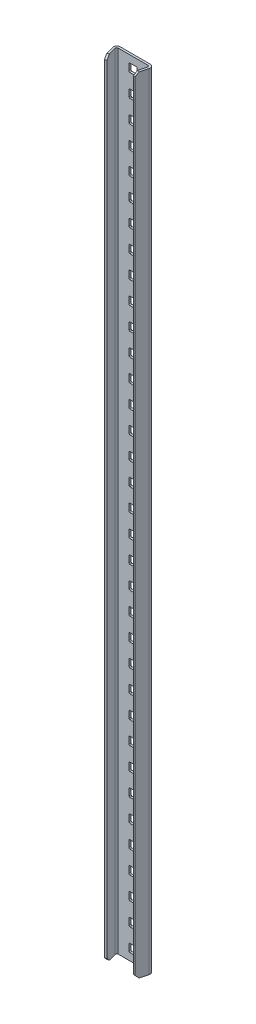
from build123d import *

# Parameters (mm, degrees)
BOSS_EXTRUDE1_DEPTH = 444.5
SKETCH2_W           = 4.6228
SKETCH2_H           = 4.6228
CUT_EXTRUDE1_DEPTH  = 293.384620107
SKETCH3_W           = 4.6228
SKETCH3_H           = 4.6228
CUT_EXTRUDE2_DEPTH  = 293.384620107
SKETCH4_W           = 4.6228
SKETCH4_H           = 4.6228
CUT_EXTRUDE3_DEPTH  = 293.384620107
SKETCH5_W           = 4.6228
SKETCH5_H           = 4.6228
CUT_EXTRUDE4_DEPTH  = 293.384620107
SKETCH6_W           = 4.6228
SKETCH6_H           = 4.6228
CUT_EXTRUDE5_DEPTH  = 293.384620107
SKETCH7_W           = 4.6228
SKETCH7_H           = 4.6228
CUT_EXTRUDE6_DEPTH  = 293.384620107
SKETCH8_W           = 4.6228
SKETCH8_H           = 4.6228
CUT_EXTRUDE7_DEPTH  = 293.384620107
SKETCH9_W           = 4.6228
SKETCH9_H           = 4.6228
CUT_EXTRUDE8_DEPTH  = 293.384620107
SKETCH10_W          = 4.6228
SKETCH10_H          = 4.6228
CUT_EXTRUDE9_DEPTH  = 293.384620107
SKETCH11_W          = 4.6228
SKETCH11_H          = 4.6228
CUT_EXTRUDE10_DEPTH = 293.384620107
SKETCH12_W          = 4.6228
SKETCH12_H          = 4.6228
CUT_EXTRUDE11_DEPTH = 293.384620107
SKETCH13_W          = 4.6228
SKETCH13_H          = 4.6228
CUT_EXTRUDE12_DEPTH = 293.384620107
SKETCH14_W          = 4.6228
SKETCH14_H          = 4.6228
CUT_EXTRUDE13_DEPTH = 293.384620107
SKETCH15_W          = 4.6228
SKETCH15_H          = 4.6228
CUT_EXTRUDE14_DEPTH = 293.384620107
SKETCH16_W          = 4.6228
SKETCH16_H          = 4.6228
CUT_EXTRUDE15_DEPTH = 293.384620107
SKETCH17_W          = 4.6228
SKETCH17_H          = 4.6228
CUT_EXTRUDE16_DEPTH = 293.384620107
SKETCH18_W          = 4.6228
SKETCH18_H          = 4.6228
CUT_EXTRUDE17_DEPTH = 293.384620107
SKETCH19_W          = 4.6228
SKETCH19_H          = 4.6228
CUT_EXTRUDE18_DEPTH = 293.384620107
SKETCH20_W          = 4.6228
SKETCH20_H          = 4.6228
CUT_EXTRUDE19_DEPTH = 293.384620107
SKETCH21_W          = 4.6228
SKETCH21_H          = 4.6228
CUT_EXTRUDE20_DEPTH = 293.384620107
SKETCH22_W          = 4.6228
SKETCH22_H          = 4.6228
CUT_EXTRUDE21_DEPTH = 293.384620107
SKETCH23_W          = 4.6228
SKETCH23_H          = 4.6228
CUT_EXTRUDE22_DEPTH = 293.384620107
SKETCH24_W          = 4.6228
SKETCH24_H          = 4.6228
CUT_EXTRUDE23_DEPTH = 293.384620107
SKETCH25_W          = 4.6228
SKETCH25_H          = 4.6228
CUT_EXTRUDE24_DEPTH = 293.384620107
SKETCH26_W          = 4.6228
SKETCH26_H          = 4.6228
CUT_EXTRUDE25_DEPTH = 293.384620107
SKETCH27_W          = 4.6228
SKETCH27_H          = 4.6228
CUT_EXTRUDE26_DEPTH = 293.384620107
SKETCH28_W          = 4.6228
SKETCH28_H          = 4.6228
CUT_EXTRUDE27_DEPTH = 293.384620107
SKETCH29_W          = 4.6228
SKETCH29_H          = 4.6228
CUT_EXTRUDE28_DEPTH = 293.384620107
SKETCH30_W          = 4.6228
SKETCH30_H          = 4.6228
CUT_EXTRUDE29_DEPTH = 293.384620107
SKETCH31_W          = 4.6228
SKETCH31_H          = 4.6228
CUT_EXTRUDE30_DEPTH = 293.384620107
SKETCH32_W          = 4.6228
SKETCH32_H          = 4.6228
CUT_EXTRUDE31_DEPTH = 293.384620107
SKETCH33_W          = 4.6228
SKETCH33_H          = 4.6228
CUT_EXTRUDE32_DEPTH = 293.384620107
SKETCH34_W          = 4.6228
SKETCH34_H          = 4.6228
CUT_EXTRUDE33_DEPTH = 293.384620107
SKETCH35_W          = 4.6228
SKETCH35_H          = 4.6228
CUT_EXTRUDE34_DEPTH = 293.384620107
SKETCH36_W          = 4.6228
SKETCH36_H          = 4.6228
CUT_EXTRUDE35_DEPTH = 293.418269127
CHAMFER1_SIZE       = 1.905
FILLET1_R           = 0.508


with BuildPart() as part:
    # Sketch1 → Boss-Extrude1 (new body)
    with BuildSketch(Plane(origin=(0, 292.1, 0), x_dir=(1, 0, 0), z_dir=(0, 1, 0))):
        with BuildLine():
            Line((9.195785156, -2.151415434), (7.497741104, -8.488602111))
            Line((7.497741104, -8.488602111), (8.656852096, -8.799184965))
            Line((8.656852096, -8.799184965), (10.354896148, -2.461998288))
            ThreePointArc((10.354896148, -2.461998288), (10.01737888, -0.765184397), (8.465738417, 0))
            Line((8.465738417, 0), (-8.465738417, 0))
            ThreePointArc((-8.465738417, 0), (-10.01737888, -0.765184397), (-10.354896148, -2.461998288))
            Line((-10.354896148, -2.461998288), (-8.656852096, -8.799184965))
            Line((-8.656852096, -8.799184965), (-7.497741104, -8.488602111))
            Line((-7.497741104, -8.488602111), (-9.195785156, -2.151415434))
            ThreePointArc((-9.195785156, -2.151415434), (-9.065354872, -1.495698112), (-8.465738417, -1.2))
            Line((-8.465738417, -1.2), (8.465738417, -1.2))
            ThreePointArc((8.465738417, -1.2), (9.065354872, -1.495698112), (9.195785156, -2.151415434))
        make_face()
    extrude(amount=-BOSS_EXTRUDE1_DEPTH)

    # Sketch2 → Cut-Extrude1 (cut, through all)
    with BuildSketch(Plane.XY.offset(1.2)):
        with Locations((0, 146.05)):
            Rectangle(SKETCH2_W, SKETCH2_H)
    extrude(amount=-CUT_EXTRUDE1_DEPTH, mode=Mode.SUBTRACT)

    # Sketch3 → Cut-Extrude2 (cut, through all)
    with BuildSketch(Plane.XY.offset(1.2)):
        with Locations((0, 133.35)):
            Rectangle(SKETCH3_W, SKETCH3_H)
    extrude(amount=-CUT_EXTRUDE2_DEPTH, mode=Mode.SUBTRACT)

    # Sketch4 → Cut-Extrude3 (cut, through all)
    with BuildSketch(Plane.XY.offset(1.2)):
        with Locations((0, 120.65)):
            Rectangle(SKETCH4_W, SKETCH4_H)
    extrude(amount=-CUT_EXTRUDE3_DEPTH, mode=Mode.SUBTRACT)

    # Sketch5 → Cut-Extrude4 (cut, through all)
    with BuildSketch(Plane.XY.offset(1.2)):
        with Locations((0, 107.95)):
            Rectangle(SKETCH5_W, SKETCH5_H)
    extrude(amount=-CUT_EXTRUDE4_DEPTH, mode=Mode.SUBTRACT)

    # Sketch6 → Cut-Extrude5 (cut, through all)
    with BuildSketch(Plane.XY.offset(1.2)):
        with Locations((0, 95.25)):
            Rectangle(SKETCH6_W, SKETCH6_H)
    extrude(amount=-CUT_EXTRUDE5_DEPTH, mode=Mode.SUBTRACT)

    # Sketch7 → Cut-Extrude6 (cut, through all)
    with BuildSketch(Plane.XY.offset(1.2)):
        with Locations((0, 82.55)):
            Rectangle(SKETCH7_W, SKETCH7_H)
    extrude(amount=-CUT_EXTRUDE6_DEPTH, mode=Mode.SUBTRACT)

    # Sketch8 → Cut-Extrude7 (cut, through all)
    with BuildSketch(Plane.XY.offset(1.2)):
        with Locations((0, 69.85)):
            Rectangle(SKETCH8_W, SKETCH8_H)
    extrude(amount=-CUT_EXTRUDE7_DEPTH, mode=Mode.SUBTRACT)

    # Sketch9 → Cut-Extrude8 (cut, through all)
    with BuildSketch(Plane.XY.offset(1.2)):
        with Locations((0, 57.15)):
            Rectangle(SKETCH9_W, SKETCH9_H)
    extrude(amount=-CUT_EXTRUDE8_DEPTH, mode=Mode.SUBTRACT)

    # Sketch10 → Cut-Extrude9 (cut, through all)
    with BuildSketch(Plane.XY.offset(1.2)):
        with Locations((0, 44.45)):
            Rectangle(SKETCH10_W, SKETCH10_H)
    extrude(amount=-CUT_EXTRUDE9_DEPTH, mode=Mode.SUBTRACT)

    # Sketch11 → Cut-Extrude10 (cut, through all)
    with BuildSketch(Plane.XY.offset(1.2)):
        with Locations((0, 31.75)):
            Rectangle(SKETCH11_W, SKETCH11_H)
    extrude(amount=-CUT_EXTRUDE10_DEPTH, mode=Mode.SUBTRACT)

    # Sketch12 → Cut-Extrude11 (cut, through all)
    with BuildSketch(Plane.XY.offset(1.2)):
        with Locations((0, 19.05)):
            Rectangle(SKETCH12_W, SKETCH12_H)
    extrude(amount=-CUT_EXTRUDE11_DEPTH, mode=Mode.SUBTRACT)

    # Sketch13 → Cut-Extrude12 (cut, through all)
    with BuildSketch(Plane.XY.offset(1.2)):
        with Locations((0, 6.35)):
            Rectangle(SKETCH13_W, SKETCH13_H)
    extrude(amount=-CUT_EXTRUDE12_DEPTH, mode=Mode.SUBTRACT)

    # Sketch14 → Cut-Extrude13 (cut, through all)
    with BuildSketch(Plane.XY.offset(1.2)):
        with Locations((0, -6.35)):
            Rectangle(SKETCH14_W, SKETCH14_H)
    extrude(amount=-CUT_EXTRUDE13_DEPTH, mode=Mode.SUBTRACT)

    # Sketch15 → Cut-Extrude14 (cut, through all)
    with BuildSketch(Plane.XY.offset(1.2)):
        with Locations((0, -133.35)):
            Rectangle(SKETCH15_W, SKETCH15_H)
    extrude(amount=-CUT_EXTRUDE14_DEPTH, mode=Mode.SUBTRACT)

    # Sketch16 → Cut-Extrude15 (cut, through all)
    with BuildSketch(Plane.XY.offset(1.2)):
        with Locations((0, -146.05)):
            Rectangle(SKETCH16_W, SKETCH16_H)
    extrude(amount=-CUT_EXTRUDE15_DEPTH, mode=Mode.SUBTRACT)

    # Sketch17 → Cut-Extrude16 (cut, through all)
    with BuildSketch(Plane.XY.offset(1.2)):
        with Locations((0, -120.65)):
            Rectangle(SKETCH17_W, SKETCH17_H)
    extrude(amount=-CUT_EXTRUDE16_DEPTH, mode=Mode.SUBTRACT)

    # Sketch18 → Cut-Extrude17 (cut, through all)
    with BuildSketch(Plane.XY.offset(1.2)):
        with Locations((0, -107.95)):
            Rectangle(SKETCH18_W, SKETCH18_H)
    extrude(amount=-CUT_EXTRUDE17_DEPTH, mode=Mode.SUBTRACT)

    # Sketch19 → Cut-Extrude18 (cut, through all)
    with BuildSketch(Plane.XY.offset(1.2)):
        with Locations((0, -95.25)):
            Rectangle(SKETCH19_W, SKETCH19_H)
    extrude(amount=-CUT_EXTRUDE18_DEPTH, mode=Mode.SUBTRACT)

    # Sketch20 → Cut-Extrude19 (cut, through all)
    with BuildSketch(Plane.XY.offset(1.2)):
        with Locations((0, -82.55)):
            Rectangle(SKETCH20_W, SKETCH20_H)
    extrude(amount=-CUT_EXTRUDE19_DEPTH, mode=Mode.SUBTRACT)

    # Sketch21 → Cut-Extrude20 (cut, through all)
    with BuildSketch(Plane.XY.offset(1.2)):
        with Locations((0, -69.85)):
            Rectangle(SKETCH21_W, SKETCH21_H)
    extrude(amount=-CUT_EXTRUDE20_DEPTH, mode=Mode.SUBTRACT)

    # Sketch22 → Cut-Extrude21 (cut, through all)
    with BuildSketch(Plane.XY.offset(1.2)):
        with Locations((0, -57.15)):
            Rectangle(SKETCH22_W, SKETCH22_H)
    extrude(amount=-CUT_EXTRUDE21_DEPTH, mode=Mode.SUBTRACT)

    # Sketch23 → Cut-Extrude22 (cut, through all)
    with BuildSketch(Plane.XY.offset(1.2)):
        with Locations((0, -44.45)):
            Rectangle(SKETCH23_W, SKETCH23_H)
    extrude(amount=-CUT_EXTRUDE22_DEPTH, mode=Mode.SUBTRACT)

    # Sketch24 → Cut-Extrude23 (cut, through all)
    with BuildSketch(Plane.XY.offset(1.2)):
        with Locations((0, -31.75)):
            Rectangle(SKETCH24_W, SKETCH24_H)
    extrude(amount=-CUT_EXTRUDE23_DEPTH, mode=Mode.SUBTRACT)

    # Sketch25 → Cut-Extrude24 (cut, through all)
    with BuildSketch(Plane.XY.offset(1.2)):
        with Locations((0, 158.75)):
            Rectangle(SKETCH25_W, SKETCH25_H)
    extrude(amount=-CUT_EXTRUDE24_DEPTH, mode=Mode.SUBTRACT)

    # Sketch26 → Cut-Extrude25 (cut, through all)
    with BuildSketch(Plane.XY.offset(1.2)):
        with Locations((0, 171.45)):
            Rectangle(SKETCH26_W, SKETCH26_H)
    extrude(amount=-CUT_EXTRUDE25_DEPTH, mode=Mode.SUBTRACT)

    # Sketch27 → Cut-Extrude26 (cut, through all)
    with BuildSketch(Plane.XY.offset(1.2)):
        with Locations((0, 184.15)):
            Rectangle(SKETCH27_W, SKETCH27_H)
    extrude(amount=-CUT_EXTRUDE26_DEPTH, mode=Mode.SUBTRACT)

    # Sketch28 → Cut-Extrude27 (cut, through all)
    with BuildSketch(Plane.XY.offset(1.2)):
        with Locations((0, 196.85)):
            Rectangle(SKETCH28_W, SKETCH28_H)
    extrude(amount=-CUT_EXTRUDE27_DEPTH, mode=Mode.SUBTRACT)

    # Sketch29 → Cut-Extrude28 (cut, through all)
    with BuildSketch(Plane.XY.offset(1.2)):
        with Locations((0, 209.55)):
            Rectangle(SKETCH29_W, SKETCH29_H)
    extrude(amount=-CUT_EXTRUDE28_DEPTH, mode=Mode.SUBTRACT)

    # Sketch30 → Cut-Extrude29 (cut, through all)
    with BuildSketch(Plane.XY.offset(1.2)):
        with Locations((0, 222.25)):
            Rectangle(SKETCH30_W, SKETCH30_H)
    extrude(amount=-CUT_EXTRUDE29_DEPTH, mode=Mode.SUBTRACT)

    # Sketch31 → Cut-Extrude30 (cut, through all)
    with BuildSketch(Plane.XY.offset(1.2)):
        with Locations((0, 234.95)):
            Rectangle(SKETCH31_W, SKETCH31_H)
    extrude(amount=-CUT_EXTRUDE30_DEPTH, mode=Mode.SUBTRACT)

    # Sketch32 → Cut-Extrude31 (cut, through all)
    with BuildSketch(Plane.XY.offset(1.2)):
        with Locations((0, 247.65)):
            Rectangle(SKETCH32_W, SKETCH32_H)
    extrude(amount=-CUT_EXTRUDE31_DEPTH, mode=Mode.SUBTRACT)

    # Sketch33 → Cut-Extrude32 (cut, through all)
    with BuildSketch(Plane.XY.offset(1.2)):
        with Locations((0, 260.35)):
            Rectangle(SKETCH33_W, SKETCH33_H)
    extrude(amount=-CUT_EXTRUDE32_DEPTH, mode=Mode.SUBTRACT)

    # Sketch34 → Cut-Extrude33 (cut, through all)
    with BuildSketch(Plane.XY.offset(1.2)):
        with Locations((0, 273.05)):
            Rectangle(SKETCH34_W, SKETCH34_H)
    extrude(amount=-CUT_EXTRUDE33_DEPTH, mode=Mode.SUBTRACT)

    # Sketch35 → Cut-Extrude34 (cut, through all)
    with BuildSketch(Plane.XY.offset(1.2)):
        with Locations((0, 285.75)):
            Rectangle(SKETCH35_W, SKETCH35_H)
    extrude(amount=-CUT_EXTRUDE34_DEPTH, mode=Mode.SUBTRACT)

    # Sketch36 → Cut-Extrude35 (cut, through all)
    with BuildSketch(Plane(origin=(0, 0, 0), x_dir=(-1, 0, 0), z_dir=(0, 0, -1))):
        with Locations((0, -19.05)):
            Rectangle(SKETCH36_W, SKETCH36_H)
    extrude(amount=-CUT_EXTRUDE35_DEPTH, mode=Mode.SUBTRACT)

    # Chamfer1
    chamfer1_edges = [part.edges().sort_by_distance(p)[0] for p in [
        (-8.0772966, 292.1, 8.643893538),
        (-8.0772966, -152.4, 8.643893538),
        (8.0772966, 292.1, 8.643893538),
        (8.0772966, -152.4, 8.643893538),
    ]]
    chamfer(chamfer1_edges, length=CHAMFER1_SIZE)

    # Fillet1
    fillet1_edges = [part.edges().sort_by_distance(p)[0] for p in [
        (2.3114, 110.2614, 0.6),
        (2.3114, 8.6614, 0.6),
        (2.3114, 186.4614, 0.6),
        (2.3114, -21.3614, 0.6),
        (2.3114, 59.4614, 0.6),
        (-2.3114, -21.3614, 0.6),
        (2.3114, 211.8614, 0.6),
        (-2.3114, -16.7386, 0.6),
        (2.3114, 161.0614, 0.6),
        (2.3114, -16.7386, 0.6),
        (2.3114, 34.0614, 0.6),
        (2.3114, -34.0614, 0.6),
        (2.3114, 84.8614, 0.6),
        (-2.3114, -34.0614, 0.6),
        (2.3114, 135.6614, 0.6),
        (-2.3114, -29.4386, 0.6),
        (2.3114, 199.1614, 0.6),
        (2.3114, -29.4386, 0.6),
        (2.3114, 173.7614, 0.6),
        (2.3114, -46.7614, 0.6),
        (2.3114, -4.0386, 0.6),
        (-2.3114, -46.7614, 0.6),
        (2.3114, 21.3614, 0.6),
        (-2.3114, -42.1386, 0.6),
        (2.3114, 46.7614, 0.6),
        (2.3114, -42.1386, 0.6),
        (2.3114, 72.1614, 0.6),
        (2.3114, -59.4614, 0.6),
        (2.3114, 97.5614, 0.6),
        (-2.3114, -59.4614, 0.6),
        (2.3114, 122.9614, 0.6),
        (-2.3114, -54.8386, 0.6),
        (2.3114, 148.3614, 0.6),
        (2.3114, -54.8386, 0.6),
        (-2.3114, 194.5386, 0.6),
        (2.3114, -72.1614, 0.6),
        (-2.3114, 181.8386, 0.6),
        (-2.3114, -72.1614, 0.6),
        (-2.3114, 169.1386, 0.6),
        (-2.3114, -67.5386, 0.6),
        (-2.3114, 156.4386, 0.6),
        (2.3114, -67.5386, 0.6),
        (-2.3114, -8.6614, 0.6),
        (2.3114, -84.8614, 0.6),
        (-2.3114, 4.0386, 0.6),
        (-2.3114, -84.8614, 0.6),
        (-2.3114, 16.7386, 0.6),
        (-2.3114, -80.2386, 0.6),
        (-2.3114, 29.4386, 0.6),
        (2.3114, -80.2386, 0.6),
        (-2.3114, 42.1386, 0.6),
        (2.3114, -97.5614, 0.6),
        (-2.3114, 54.8386, 0.6),
        (-2.3114, -97.5614, 0.6),
        (-2.3114, 67.5386, 0.6),
        (-2.3114, -92.9386, 0.6),
        (-2.3114, 80.2386, 0.6),
        (2.3114, -92.9386, 0.6),
        (-2.3114, 92.9386, 0.6),
        (2.3114, -110.2614, 0.6),
        (-2.3114, 105.6386, 0.6),
        (-2.3114, -110.2614, 0.6),
        (-2.3114, 118.3386, 0.6),
        (-2.3114, -105.6386, 0.6),
        (-2.3114, 131.0386, 0.6),
        (2.3114, -105.6386, 0.6),
        (-2.3114, 143.7386, 0.6),
        (2.3114, -122.9614, 0.6),
        (-2.3114, 211.8614, 0.6),
        (-2.3114, -122.9614, 0.6),
        (2.3114, 194.5386, 0.6),
        (-2.3114, -118.3386, 0.6),
        (-2.3114, 199.1614, 0.6),
        (2.3114, -118.3386, 0.6),
        (2.3114, 181.8386, 0.6),
        (-2.3114, -148.3614, 0.6),
        (-2.3114, 186.4614, 0.6),
        (-2.3114, -143.7386, 0.6),
        (2.3114, 169.1386, 0.6),
        (2.3114, -143.7386, 0.6),
        (-2.3114, 173.7614, 0.6),
        (2.3114, -148.3614, 0.6),
        (2.3114, 156.4386, 0.6),
        (-2.3114, -135.6614, 0.6),
        (-2.3114, 161.0614, 0.6),
        (-2.3114, -131.0386, 0.6),
        (2.3114, -8.6614, 0.6),
        (2.3114, -131.0386, 0.6),
        (-2.3114, -4.0386, 0.6),
        (2.3114, -135.6614, 0.6),
        (2.3114, 4.0386, 0.6),
        (2.3114, 283.4386, 0.6),
        (-2.3114, 8.6614, 0.6),
        (-2.3114, 283.4386, 0.6),
        (2.3114, 16.7386, 0.6),
        (-2.3114, 288.0614, 0.6),
        (-2.3114, 21.3614, 0.6),
        (2.3114, 288.0614, 0.6),
        (2.3114, 29.4386, 0.6),
        (2.3114, 270.7386, 0.6),
        (-2.3114, 34.0614, 0.6),
        (-2.3114, 270.7386, 0.6),
        (2.3114, 42.1386, 0.6),
        (-2.3114, 275.3614, 0.6),
        (-2.3114, 46.7614, 0.6),
        (2.3114, 275.3614, 0.6),
        (2.3114, 54.8386, 0.6),
        (2.3114, 258.0386, 0.6),
        (-2.3114, 59.4614, 0.6),
        (-2.3114, 258.0386, 0.6),
        (2.3114, 67.5386, 0.6),
        (-2.3114, 262.6614, 0.6),
        (-2.3114, 72.1614, 0.6),
        (2.3114, 262.6614, 0.6),
        (2.3114, 80.2386, 0.6),
        (2.3114, 245.3386, 0.6),
        (-2.3114, 84.8614, 0.6),
        (-2.3114, 245.3386, 0.6),
        (2.3114, 92.9386, 0.6),
        (-2.3114, 249.9614, 0.6),
        (-2.3114, 97.5614, 0.6),
        (2.3114, 249.9614, 0.6),
        (2.3114, 105.6386, 0.6),
        (2.3114, 232.6386, 0.6),
        (-2.3114, 110.2614, 0.6),
        (-2.3114, 232.6386, 0.6),
        (2.3114, 118.3386, 0.6),
        (-2.3114, 237.2614, 0.6),
        (-2.3114, 122.9614, 0.6),
        (2.3114, 237.2614, 0.6),
        (2.3114, 131.0386, 0.6),
        (2.3114, 219.9386, 0.6),
        (-2.3114, 135.6614, 0.6),
        (-2.3114, 219.9386, 0.6),
        (2.3114, 143.7386, 0.6),
        (-2.3114, 224.5614, 0.6),
        (-2.3114, 148.3614, 0.6),
        (2.3114, 207.2386, 0.6),
        (-2.3114, 207.2386, 0.6),
        (2.3114, 224.5614, 0.6),
    ]]
    fillet(fillet1_edges, radius=FILLET1_R)


solid = part.part
